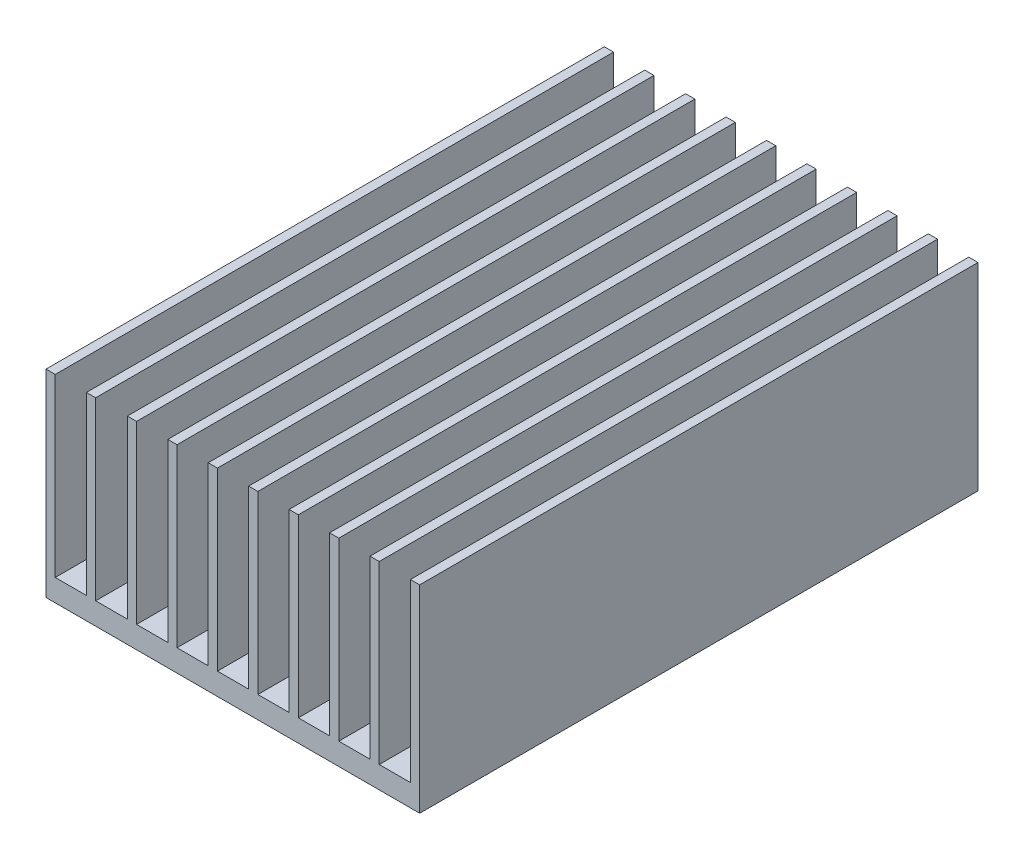
from build123d import *

# Parameters (mm, degrees)
BOSS_EXTRUDE1_DEPTH = 127
SKETCH5_W           = 20
SKETCH5_H           = 30
BOSS_EXTRUDE4_DEPTH = 1


# Read off the part's stored shape, not the designer's step: Split2
with BuildPart() as part:
    # Sketch1 → Boss-Extrude1 (new body)
    with BuildSketch(Plane(origin=(0, 0, -127), x_dir=(-1, 0, 0), z_dir=(0, 0, -1))):
        Polygon((85, 45), (82.9, 45), (82.9, 5), (75.8, 5), (75.8, 45), (73.7, 45), (73.7, 5), (66.5, 5), (66.5, 45), (64.4, 45), (64.4, 5), (57.3, 5), (57.3, 45), (55.2, 45), (55.2, 5), (48.1, 5), (48.1, 45), (46, 45), (46, 5), (38.9, 5), (38.9, 45), (36.8, 45), (36.8, 5), (29.7, 5), (29.7, 45), (27.6, 45), (27.6, 5), (20.5, 5), (20.5, 45), (18.4, 45), (18.4, 5), (11.3, 5), (11.3, 45), (9.2, 45), (9.2, 5), (2.1, 5), (2.1, 45), (0, 45), (0, 0), (85, 0), align=None)
    extrude(amount=-BOSS_EXTRUDE1_DEPTH)

    # Sketch5 → Boss-Extrude4 (add)
    with BuildSketch(Plane(origin=(0, 0, 0), x_dir=(-1, 0, 0), z_dir=(0, -1, 0))):
        with Locations((41.830664792, 60.868181684)):
            Rectangle(SKETCH5_W, SKETCH5_H)
    extrude(amount=BOSS_EXTRUDE4_DEPTH)


with BuildPart() as body_2:
    # Split2: the piece on the far side of the plane
    add(part.part)
    split(bisect_by=Plane(origin=(0, 0, 0), x_dir=(1, 0, 0), z_dir=(0, 1, 0)), keep=Keep.BOTTOM)


with BuildPart() as part_1:
    add(part.part)

    # Split2
    split(bisect_by=Plane(origin=(0, 0, 0), x_dir=(1, 0, 0), z_dir=(0, 1, 0)), keep=Keep.TOP)


solid = Compound([body_2.part, part_1.part])
